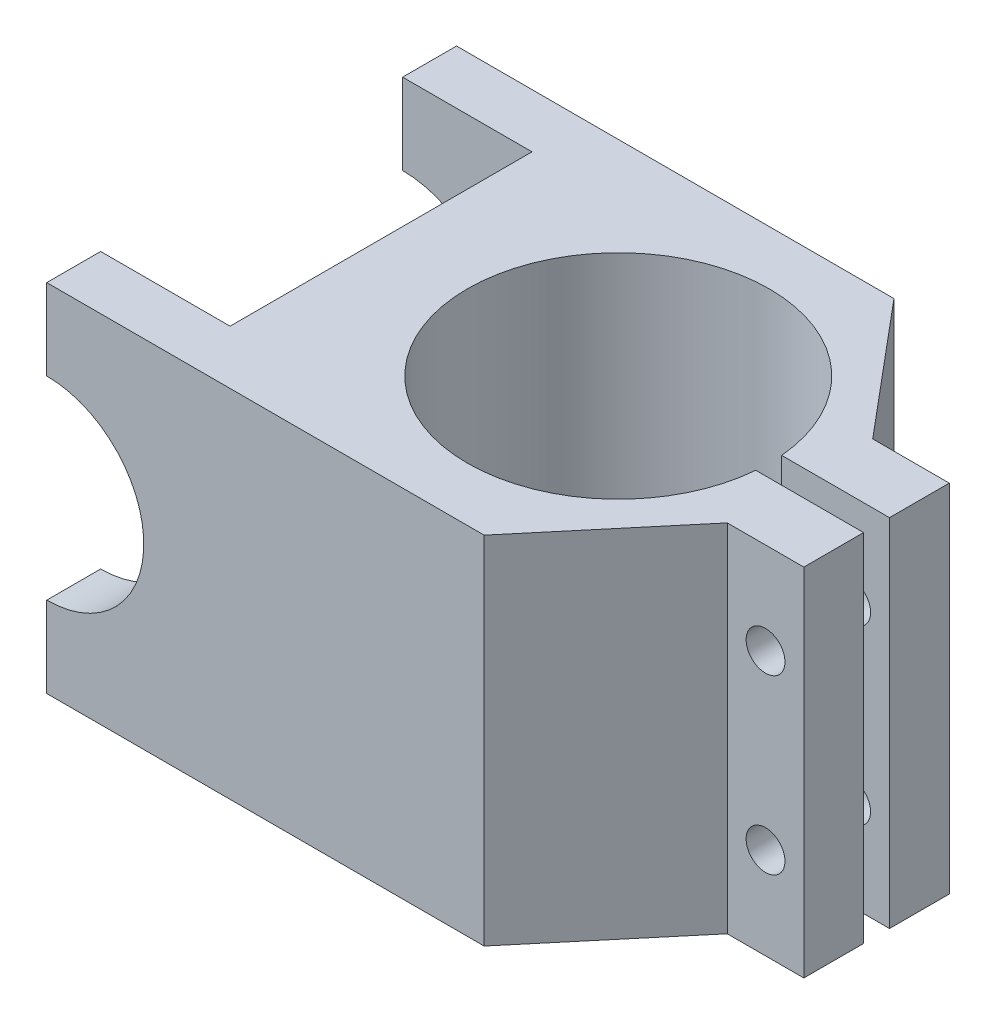
from build123d import *

# Parameters (mm, degrees)
BOSS_EXTRUDE1_DEPTH       = 41.91
SKETCH2_R                 = 11.43
CUT_EXTRUDE1_DEPTH        = 56.388
SKETCH3_W                 = 21.064654828
SKETCH3_H                 = 3.048
CUT_EXTRUDE3_DEPTH        = 56.388
SKETCH4_R                 = 2.2499955
CUT_EXTRUDE4_DEPTH        = 56.388
SKETCH5_R                 = 2.286
CUT_EXTRUDE5_DEPTH        = 56.388
CUT_EXTRUDE6_DEPTH        = 137.962648554
M4X0_7_TAPPED_HOLE1_D     = 3.3
M4X0_7_TAPPED_HOLE1_DEPTH = 11.43
M4X0_7_TAPPED_HOLE1_TIP   = 0.991420021


with BuildPart() as part:
    # Sketch1 → Boss-Extrude1 (new body)
    with BuildSketch(Plane(origin=(0, 0, 0), x_dir=(1, 0, 0), z_dir=(0, 1, 0))):
        with BuildLine():
            Line((-121.13336204, 24.13), (-48.027058794, 24.13))
            Line((-48.027058794, 24.13), (-34.965614565, 8.563976916))
            Line((-34.965614565, 8.563976916), (-25.948796733, 8.563976916))
            Line((-25.948796733, 8.563976916), (-25.948796733, 1.524))
            Line((-25.948796733, 1.524), (-38.648796733, 1.524))
            ThreePointArc((-38.648796733, 1.524), (-74.14336204, 0), (-38.648796733, -1.524))
            Line((-38.648796733, -1.524), (-25.948796733, -1.524))
            Line((-25.948796733, -1.524), (-25.948796733, -8.563976916))
            Line((-25.948796733, -8.563976916), (-34.965614565, -8.563976916))
            Line((-34.965614565, -8.563976916), (-48.027058794, -24.13))
            Line((-48.027058794, -24.13), (-121.13336204, -24.13))
            Line((-121.13336204, -24.13), (-121.13336204, -17.78))
            Line((-121.13336204, -17.78), (-84.30336204, -17.78))
            Line((-84.30336204, -17.78), (-84.30336204, 17.78))
            Line((-84.30336204, 17.78), (-121.13336204, 17.78))
            Line((-121.13336204, 17.78), (-121.13336204, 24.13))
        make_face()
    extrude(amount=BOSS_EXTRUDE1_DEPTH)

    # Sketch2 → Cut-Extrude1 (cut)
    with BuildSketch(Plane.XY.offset(24.13)):
        with Locations((-99.54336204, 20.955)):
            Circle(SKETCH2_R)
    extrude(amount=-CUT_EXTRUDE1_DEPTH, mode=Mode.SUBTRACT)

    # Sketch3 → Cut-Extrude3 (cut)
    with BuildSketch(Plane.XY.offset(24.13)):
        with Locations((-110.601034626, 20.955)):
            Rectangle(SKETCH3_W, SKETCH3_H)
        Polygon((-121.13336204, 41.91), (-121.13336204, 27.305), (-114.78336204, 27.305), (-104.400968543, 41.91), align=None)
        Polygon((-121.13336204, 14.605), (-121.13336204, 0), (-104.400968543, 0), (-114.78336204, 14.605), align=None)
    extrude(amount=-CUT_EXTRUDE3_DEPTH, mode=Mode.SUBTRACT)

    # Sketch4 → Cut-Extrude4 (cut)
    with BuildSketch(Plane(origin=(0, 27.305, 0), x_dir=(1, 0, 0), z_dir=(0, 1, 0))):
        with Locations((-117.95836204, 20.955)):
            Circle(SKETCH4_R)
        with Locations((-117.95836204, -20.955)):
            Circle(SKETCH4_R)
    extrude(amount=-CUT_EXTRUDE4_DEPTH, mode=Mode.SUBTRACT)

    # Sketch5 → Cut-Extrude5 (cut)
    with BuildSketch(Plane.XY.offset(8.563976916)):
        with Locations((-30.457205649, 31.115)):
            Circle(SKETCH5_R)
        with Locations((-30.457205649, 10.795)):
            Circle(SKETCH5_R)
    extrude(amount=-CUT_EXTRUDE5_DEPTH, mode=Mode.SUBTRACT)

    # Sketch6 → Cut-Extrude6 (cut, through all)
    with BuildSketch(Plane(origin=(0, 0, -24.13), x_dir=(-1, 0, 0), z_dir=(0, 0, -1))):
        Polygon((99.54336204, 0), (99.54336204, 41.91), (123.387862264, 41.91), (123.387862264, -0.787411773), align=None)
    extrude(amount=-CUT_EXTRUDE6_DEPTH, mode=Mode.SUBTRACT)

    # M4x0.7 Tapped Hole1
    with Locations(Plane.ZY.offset(99.54336204)):
        with Locations((-20.955, 38.1), (-20.955, 3.81), (20.955, 3.81), (20.955, 38.1)):
            Hole(M4X0_7_TAPPED_HOLE1_D / 2, depth=M4X0_7_TAPPED_HOLE1_DEPTH)
            with Locations((0, 0, -(M4X0_7_TAPPED_HOLE1_DEPTH + M4X0_7_TAPPED_HOLE1_TIP / 2))):  # 118° drill point
                Cone(0, M4X0_7_TAPPED_HOLE1_D / 2, M4X0_7_TAPPED_HOLE1_TIP, mode=Mode.SUBTRACT)


solid = part.part
